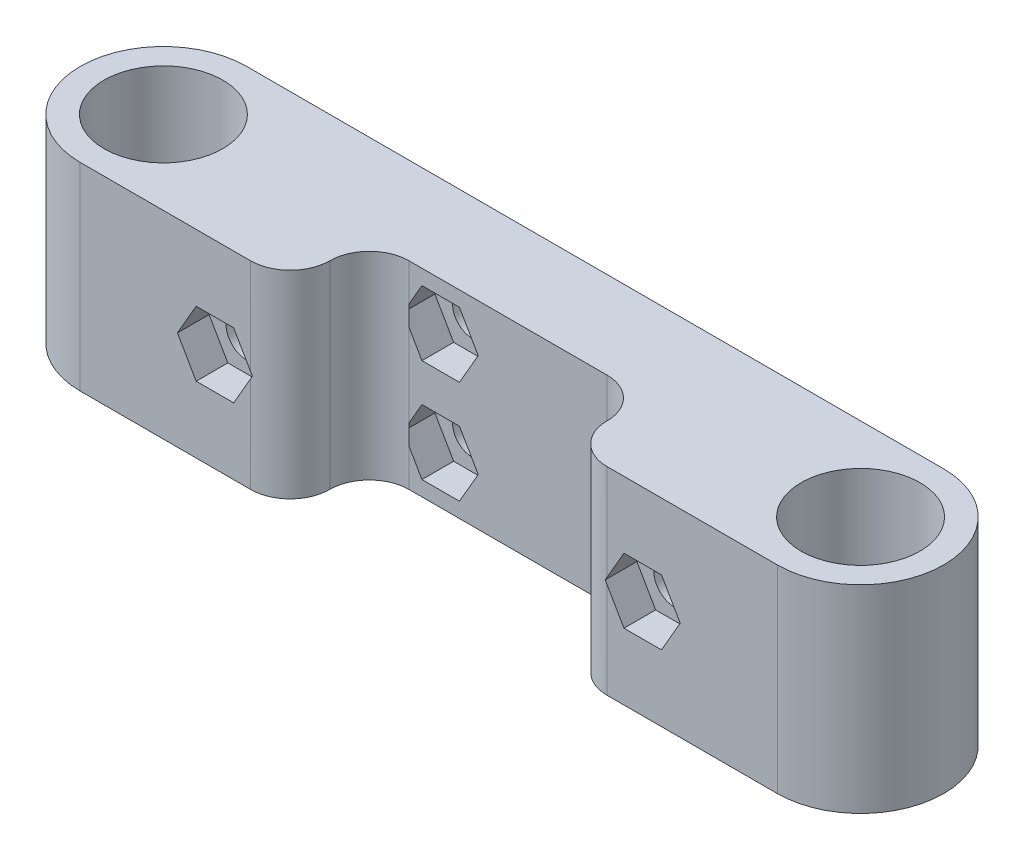
from build123d import *

# Parameters (mm, degrees)
CROQUIS1_R              = 7.5
SALIENTE_EXTRUIR1_DEPTH = 25
CROQUIS6_W              = 35
CROQUIS6_H              = 20
CORTAR_EXTRUIR3_DEPTH   = 103.164083709
REDONDEO3_START         = -1
REDONDEO3_DEPTH         = 27
REDONDEO3_2_DEPTH       = 25
CROQUIS7_R              = 2.5
CORTAR_EXTRUIR4_DEPTH   = 104.770178761
CROQUIS8_R              = 4.375
CORTAR_EXTRUIR5_DEPTH   = 5
CROQUIS9_R              = 2.6
CORTAR_EXTRUIR6_DEPTH   = 104.770178761
CORTAR_EXTRUIR7_DEPTH   = 4
CORTAR_EXTRUIR8_DEPTH   = 4
CORTAR_EXTRUIR9_DEPTH   = 4


with BuildPart() as part:
    # Croquis1 → Saliente-Extruir1 (new body)
    with BuildSketch(Plane(origin=(0, 0, 0), x_dir=(1, 0, 0), z_dir=(0, 1, 0))):
        with BuildLine():
            Line((88, 10.5), (0, 10.5))
            ThreePointArc((0, 10.5), (-10.5, 0), (0, -10.5))
            Line((0, -10.5), (88, -10.5))
            ThreePointArc((88, -10.5), (98.5, 0), (88, 10.5))
        make_face()
        with Locations(Location((0, 0, 0), (0, 0, 270))):
            Circle(CROQUIS1_R, mode=Mode.SUBTRACT)
        with Locations(Location((88, 0, 0), (0, 0, 270))):
            Circle(CROQUIS1_R, mode=Mode.SUBTRACT)
    extrude(amount=SALIENTE_EXTRUIR1_DEPTH)

    # Croquis6 → Cortar-Extruir3 (cut, through all)
    with BuildSketch(Plane.XZ):
        with Locations((44, 10.5)):
            Rectangle(CROQUIS6_W, CROQUIS6_H)
    extrude(amount=-CORTAR_EXTRUIR3_DEPTH, mode=Mode.SUBTRACT)

    # Redondeo3: read off the stored shape, not the designer's step
    # Redondeo3 outline → Redondeo3 (cut)
    with BuildSketch(Plane(origin=(0, 0, 0), x_dir=(1, 0, 0), z_dir=(0, 1, 0)).offset(REDONDEO3_START)):
        with BuildLine():
            Line((26.5, -10.5), (26.5, -5.5))
            ThreePointArc((26.5, -5.5), (25.035533906, -9.035533906), (21.5, -10.5))
            Line((21.5, -10.5), (26.5, -10.5))
        make_face()
        with BuildLine():
            ThreePointArc((66.5, -10.5), (62.964466094, -9.035533906), (61.5, -5.5))
            Line((61.5, -5.5), (61.5, -10.5))
            Line((61.5, -10.5), (66.5, -10.5))
        make_face()
    extrude(amount=REDONDEO3_DEPTH, mode=Mode.SUBTRACT)

    # Redondeo3 2 outline → Redondeo3 2 (add)
    with BuildSketch(Plane(origin=(0, 0, 0), x_dir=(1, 0, 0), z_dir=(0, 1, 0))):
        with BuildLine():
            Line((61.5, -0.5), (56.5, -0.5))
            ThreePointArc((56.5, -0.5), (60.035533906, -1.964466094), (61.5, -5.5))
            Line((61.5, -5.5), (61.5, -0.5))
        make_face()
        with BuildLine():
            ThreePointArc((26.5, -5.5), (27.964466094, -1.964466094), (31.5, -0.5))
            Line((31.5, -0.5), (26.5, -0.5))
            Line((26.5, -0.5), (26.5, -5.5))
        make_face()
    extrude(amount=REDONDEO3_2_DEPTH)

    # Croquis7 → Cortar-Extruir4 (cut, through all)
    with BuildSketch(Plane(origin=(0, 0, -10.5), x_dir=(-1, 0, 0), z_dir=(0, 0, -1))):
        with Locations((-35.5, 19)):
            Circle(CROQUIS7_R)
        with Locations((-35.5, 6)):
            Circle(CROQUIS7_R)
    extrude(amount=-CORTAR_EXTRUIR4_DEPTH, mode=Mode.SUBTRACT)

    # Croquis8 → Cortar-Extruir5 (cut)
    with BuildSketch(Plane(origin=(0, 0, -10.5), x_dir=(-1, 0, 0), z_dir=(0, 0, -1))):
        with Locations((-35.5, 19)):
            Circle(CROQUIS8_R)
        with Locations((-35.5, 6)):
            Circle(CROQUIS8_R)
    extrude(amount=-CORTAR_EXTRUIR5_DEPTH, mode=Mode.SUBTRACT)

    # Croquis9 → Cortar-Extruir6 (cut, through all)
    with BuildSketch(Plane(origin=(0, 0, -10.5), x_dir=(-1, 0, 0), z_dir=(0, 0, -1))):
        with Locations((-71, 12.5)):
            Circle(CROQUIS9_R)
        with Locations(Location((-17, 12.5, 0), (0, 0, 180))):
            Circle(CROQUIS9_R)
    extrude(amount=-CORTAR_EXTRUIR6_DEPTH, mode=Mode.SUBTRACT)

    # Croquis10 → Cortar-Extruir7 (cut)
    with BuildSketch(Plane.XY.offset(10.5)):
        Polygon((75.734272207, 12.5), (73.367136104, 16.6), (68.632863896, 16.6), (66.265727793, 12.5), (68.632863896, 8.4), (73.367136104, 8.4), align=None)
    extrude(amount=-CORTAR_EXTRUIR7_DEPTH, mode=Mode.SUBTRACT)

    # Croquis11 → Cortar-Extruir8 (cut)
    with BuildSketch(Plane.XY.offset(0.5)):
        Polygon((40.234272207, 6), (37.867136104, 10.1), (33.132863896, 10.1), (30.765727793, 6), (33.132863896, 1.9), (37.867136104, 1.9), align=None)
        Polygon((40.234272207, 19), (37.867136104, 23.1), (33.132863896, 23.1), (30.765727793, 19), (33.132863896, 14.9), (37.867136104, 14.9), align=None)
    extrude(amount=-CORTAR_EXTRUIR8_DEPTH, mode=Mode.SUBTRACT)

    # Croquis12 → Cortar-Extruir9 (cut)
    with BuildSketch(Plane.XY.offset(10.5)):
        Polygon((12.265727793, 12.5), (14.632863896, 8.4), (19.367136104, 8.4), (21.734272207, 12.5), (19.367136104, 16.6), (14.632863896, 16.6), align=None)
    extrude(amount=-CORTAR_EXTRUIR9_DEPTH, mode=Mode.SUBTRACT)


solid = part.part
